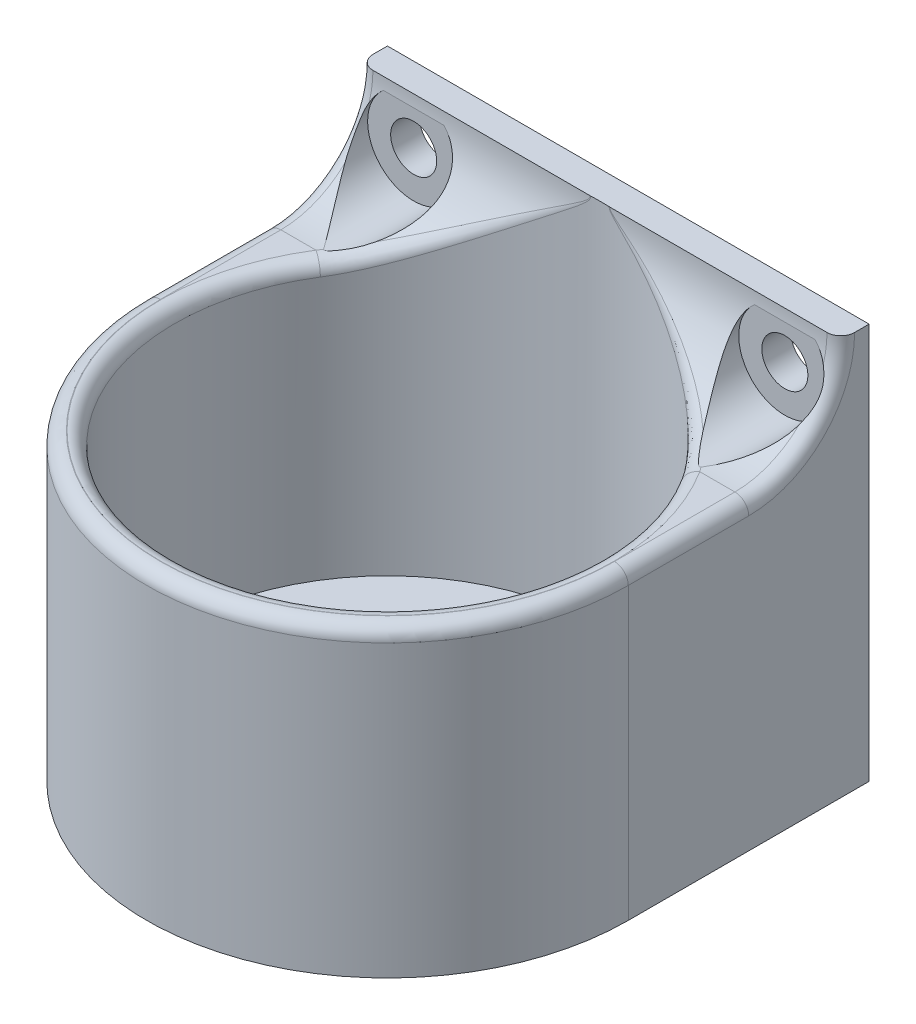
from build123d import *

# Parameters (mm, degrees)
SKETCH1_R           = 26.15
BOSS_EXTRUDE1_DEPTH = 43
BOSS_EXTRUDE2_DEPTH = 43
SKETCH3_R           = 23.1
CUT_EXTRUDE1_DEPTH  = 40
SKETCH5_W           = 67.071778783
SKETCH5_H           = 52.086057912
CUT_EXTRUDE3_DEPTH  = 10
SKETCH6_R           = 10
CUT_EXTRUDE4_DEPTH  = 3
SKETCH7_R           = 2.5
CUT_EXTRUDE5_DEPTH  = 73.581764239
FILLET5_R           = 10
FILLET7_R           = 10
FILLET8_R           = 1.5
SKETCH8_R           = 5
CUT_EXTRUDE10_DEPTH = 23


with BuildPart() as part:
    # Sketch1 → Boss-Extrude1 (new body)
    with BuildSketch(Plane(origin=(0, 0, 0), x_dir=(1, 0, 0), z_dir=(0, 1, 0))):
        with Locations(Location((0, 0, 0), (0, 0, 270))):
            Circle(SKETCH1_R)
    extrude(amount=BOSS_EXTRUDE1_DEPTH)

    # Sketch2 → Boss-Extrude2 (add)
    with BuildSketch(Plane(origin=(0, 43, 0), x_dir=(1, 0, 0), z_dir=(0, 1, 0))):
        Polygon((-26.15, 0), (-26.15, 26.15), (0, 26.15), (26.15, 26.15), (26.15, 0), align=None)
    extrude(amount=-BOSS_EXTRUDE2_DEPTH)

    # Sketch3 → Cut-Extrude1 (cut)
    with BuildSketch(Plane(origin=(0, 43, 0), x_dir=(1, 0, 0), z_dir=(0, 1, 0))):
        with Locations(Location((0, 0, 0), (0, 0, 270))):
            Circle(SKETCH3_R)
    extrude(amount=-CUT_EXTRUDE1_DEPTH, mode=Mode.SUBTRACT)

    # Sketch5 → Cut-Extrude3 (cut)
    with BuildSketch(Plane(origin=(0, 43, 0), x_dir=(1, 0, 0), z_dir=(0, 1, 0))):
        with Locations((1.028164369, -2.965921728)):
            Rectangle(SKETCH5_W, SKETCH5_H)
    extrude(amount=-CUT_EXTRUDE3_DEPTH, mode=Mode.SUBTRACT)

    # Sketch6 → Cut-Extrude4 (cut)
    with BuildSketch(Plane.XZ):
        with Locations(Location((0, 0, 0), (0, 0, 270))):
            Circle(SKETCH6_R)
    extrude(amount=-CUT_EXTRUDE4_DEPTH, mode=Mode.SUBTRACT)

    # Sketch7 → Cut-Extrude5 (cut, through all)
    with BuildSketch(Plane(origin=(0, 0, -26.15), x_dir=(-1, 0, 0), z_dir=(0, 0, -1))):
        with Locations((-20.15, 38)):
            Circle(SKETCH7_R)
        with Locations((20.15, 38)):
            Circle(SKETCH7_R)
    extrude(amount=-CUT_EXTRUDE5_DEPTH, mode=Mode.SUBTRACT)

    # Fillet5
    # the kernel refuses this fillet: 10 mm, written as the material it takes off along each edge
    with BuildSketch(Plane(origin=(0, 3, 0), x_dir=(0, 0, -1), z_dir=(-1, 0, 0))) as fillet5_piece_1:
        with BuildLine():
            CenterArc((17.141428429, 10), FILLET5_R, 224.427004001, 45.572995999)
            Line((17.141428429, 0), (17.141428429, -0.2))
            Line((17.141428429, -0.2), (10, -0.2))
            Line((10, -0.2), (9.8, 0))
            ThreePointArc((9.8, 0), (9.8, 1.5), (9.857171431, 2.86))
            Line((9.857171431, 2.86), (10, 3))
        make_face()
    revolve(axis=Axis((0, 3, 0), (0, -1, 0)), mode=Mode.SUBTRACT)

    # Fillet7
    # the kernel refuses this fillet: 10 mm, written as the material it adds along each edge
    with BuildSketch(Plane(origin=(-23.971835632, 33, -23.077107228), x_dir=(0, 0, 1), z_dir=(1, 0, 0))) as fillet7_piece_1_section:
        with BuildLine():
            CenterArc((FILLET7_R, -FILLET7_R), FILLET7_R, 90, 90)
            Line((0, -FILLET7_R), (0, 0))
            Line((0, 0), (FILLET7_R, 0))
        make_face()
    fillet7_piece_1 = extrude(amount=50.121835632, mode=Mode.PRIVATE)
    fillet7_piece_1 = fillet7_piece_1 - Plane(origin=(0, 35.367473798, 0), x_dir=(0, 0, 1), z_dir=(0, 1, 0)) * Cylinder(23.1, 141, mode=Mode.PRIVATE)
    fillet7_piece_1 = fillet7_piece_1 - Plane(origin=(-20.15, 38, -21.240377254), x_dir=(-1, 0, 0), z_dir=(0, 0, -1)) * Cylinder(2.5, 141, mode=Mode.PRIVATE)
    fillet7_piece_1 = fillet7_piece_1 - Plane(origin=(20.15, 38, -21.240377254), x_dir=(-1, 0, 0), z_dir=(0, 0, -1)) * Cylinder(2.5, 141, mode=Mode.PRIVATE)
    add(fillet7_piece_1)
    with BuildSketch(Plane(origin=(-26.15, 33, -23.077107228), x_dir=(0, 0, 1), z_dir=(1, 0, 0))) as fillet7_piece_2_section:
        with BuildLine():
            CenterArc((FILLET7_R, -FILLET7_R), FILLET7_R, 90, 90)
            Line((0, -FILLET7_R), (0, 0))
            Line((0, 0), (FILLET7_R, 0))
        make_face()
    fillet7_piece_2 = extrude(amount=50.121835632, mode=Mode.PRIVATE)
    fillet7_piece_2 = fillet7_piece_2 - Plane(origin=(0, 35.349124084, 0), x_dir=(0, 0, 1), z_dir=(0, 1, 0)) * Cylinder(23.1, 141, mode=Mode.PRIVATE)
    fillet7_piece_2 = fillet7_piece_2 - Plane(origin=(-20.15, 38, -21.185935414), x_dir=(-1, 0, 0), z_dir=(0, 0, -1)) * Cylinder(2.5, 141, mode=Mode.PRIVATE)
    fillet7_piece_2 = fillet7_piece_2 - Plane(origin=(20.15, 38, -21.185935414), x_dir=(-1, 0, 0), z_dir=(0, 0, -1)) * Cylinder(2.5, 141, mode=Mode.PRIVATE)
    add(fillet7_piece_2)

    # Fillet8
    fillet8_edges = [part.edges().sort_by_distance(p)[0] for p in [
        (0, 33, 26.15),
        (-26.15, 33, -6.538553614),
        (26.15, 33, -6.538553614),
        (-20.441271694, 33, 10.759387135),
        (10.535485656, 36.363530421, -20.557566542),
        (26.15, 35.928932188, -20.14817504),
        (-26.15, 35.928932188, -20.14817504),
        (-10.53548567, 36.363530451, -20.557566538),
    ]]
    fillet(fillet8_edges, radius=FILLET8_R)

    # Sketch8 → Cut-Extrude10 (cut)
    with BuildSketch(Plane.XY):
        with Locations((-20.15, 38)):
            Circle(SKETCH8_R)
        with Locations((20.15, 38)):
            Circle(SKETCH8_R)
    extrude(amount=-CUT_EXTRUDE10_DEPTH, mode=Mode.SUBTRACT)


solid = part.part
